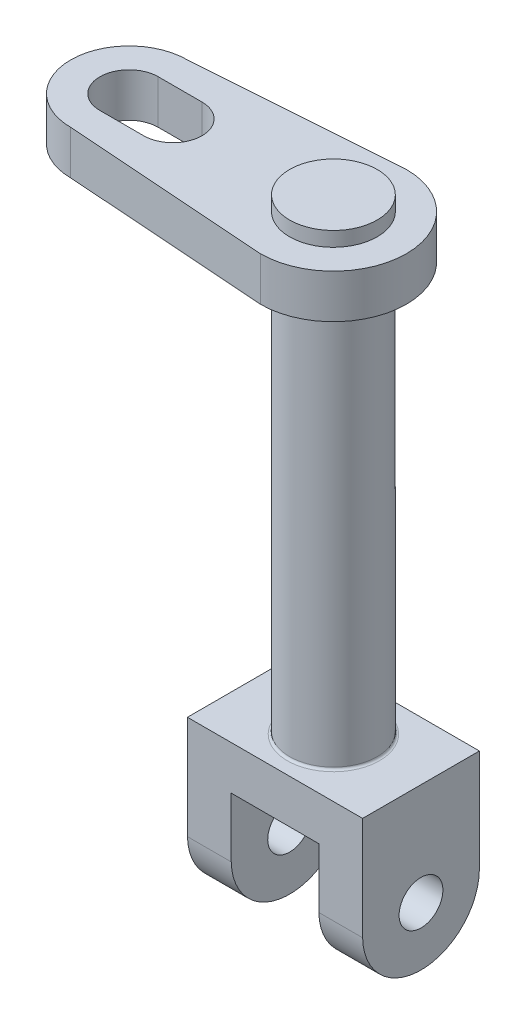
from build123d import *

# Parameters (mm, degrees)
BOSS_EXTRUDE1_DEPTH     = 12.7
CUT_EXTRUDE1_DEPTH      = 29.794641971
CUT_EXTRUDE1_DEPTH_BACK = 29.794641971
CUT_EXTRUDE2_DEPTH      = 29.794641971
CUT_EXTRUDE2_DEPTH_BACK = 29.794641971
SKETCH3_R               = 2.38125
SKETCH4_R               = 4.7625
BOSS_EXTRUDE2_DEPTH     = 44.45
BOSS_EXTRUDE3_DEPTH     = 4.7625
SKETCH6_R               = 4.7625
BOSS_EXTRUDE4_DEPTH     = 1.5875
SKETCH7_R               = 3.175
CUT_EXTRUDE3_DEPTH      = 4.7625
FILLET1_R               = 0.254
BODY_MOVE_COPY4_ANGLE   = 90


with BuildPart() as part:
    # Sketch1 → Boss-Extrude1 (new body)
    with BuildSketch(Plane(origin=(0, 0, 0), x_dir=(0, 0, -1), z_dir=(1, 0, 0))):
        Polygon((9.525, 0), (-9.525, 0), (-9.525, -17.4625), (-4.7625, -17.4625), (-4.7625, -4.7625), (4.7625, -4.7625), (4.7625, -17.4625), (9.525, -17.4625), align=None)
    extrude(amount=BOSS_EXTRUDE1_DEPTH)

    # Sketch2 → Cut-Extrude1 (cut, two sides: drawn at the far end of the back side and taken through both)
    with BuildSketch(Plane.XY.offset(9.525).offset(-CUT_EXTRUDE1_DEPTH_BACK)):
        with BuildLine():
            ThreePointArc((12.7, -11.1125), (10.840128061, -15.602628061), (6.35, -17.4625))
            Line((6.35, -17.4625), (12.7, -17.4625))
            Line((12.7, -17.4625), (12.7, -11.1125))
        make_face()
        with BuildLine():
            Line((0.001322974, -11.242114905), (0, -11.242128408))
            Line((0, -11.242128408), (0, -17.4625))
            Line((0, -17.4625), (6.35, -17.4625))
            ThreePointArc((6.35, -17.4625), (1.905933993, -15.648222359), (0.001322974, -11.242114905))
        make_face()
    extrude(amount=CUT_EXTRUDE1_DEPTH + CUT_EXTRUDE1_DEPTH_BACK, mode=Mode.SUBTRACT)

    # Sketch3 → Cut-Extrude2 (cut, two sides: drawn at the far end of the back side and taken through both)
    with BuildSketch(Plane(origin=(0, 0, -9.525), x_dir=(-1, 0, 0), z_dir=(0, 0, -1)).offset(-CUT_EXTRUDE2_DEPTH_BACK)):
        with Locations((-6.35, -11.1125)):
            Circle(SKETCH3_R)
    extrude(amount=CUT_EXTRUDE2_DEPTH + CUT_EXTRUDE2_DEPTH_BACK, mode=Mode.SUBTRACT)

    # Sketch4 → Boss-Extrude2 (add)
    with BuildSketch(Plane(origin=(0, 0, 0), x_dir=(1, 0, 0), z_dir=(0, 1, 0))):
        with Locations((6.35, 0)):
            Circle(SKETCH4_R)
    extrude(amount=BOSS_EXTRUDE2_DEPTH)

    # Sketch5 → Boss-Extrude3 (add)
    with BuildSketch(Plane(origin=(0, 44.45, 0), x_dir=(1, 0, 0), z_dir=(0, 1, 0))):
        with BuildLine():
            Line((6.35, 7.9375), (-15.875, 6.35))
            ThreePointArc((-15.875, 6.35), (-22.225, 0), (-15.875, -6.35))
            Line((-15.875, -6.35), (6.35, -7.9375))
            ThreePointArc((6.35, -7.9375), (14.2875, 0), (6.35, 7.9375))
        make_face()
        with BuildLine():
            Line((-11.1125, -3.175), (-15.875, -3.175))
            ThreePointArc((-15.875, -3.175), (-19.05, 0), (-15.875, 3.175))
            Line((-15.875, 3.175), (-11.1125, 3.175))
            ThreePointArc((-11.1125, 3.175), (-7.9375, 0), (-11.1125, -3.175))
        make_face(mode=Mode.SUBTRACT)
    extrude(amount=BOSS_EXTRUDE3_DEPTH)

    # Sketch6 → Boss-Extrude4 (add)
    with BuildSketch(Plane(origin=(0, 49.2125, 0), x_dir=(1, 0, 0), z_dir=(0, 1, 0))):
        with Locations((6.35, 0)):
            Circle(SKETCH6_R)
    extrude(amount=BOSS_EXTRUDE4_DEPTH)

    # Sketch7 → Cut-Extrude3 (cut)
    with BuildSketch(Plane.XZ.offset(4.7625)):
        with Locations((6.350661487, 0)):
            Circle(SKETCH7_R)
    extrude(amount=-CUT_EXTRUDE3_DEPTH, mode=Mode.SUBTRACT)

    # Fillet1
    fillet1_edges = [part.edges().sort_by_distance(p)[0] for p in [
        (1.5875, 0, 0),
        (1.5875, 44.45, 0),
    ]]
    fillet(fillet1_edges, radius=FILLET1_R)


with BuildPart() as body_2:
    # Split2: the piece on the far side of the plane
    add(part.part)
    split(bisect_by=Plane(origin=(12.7, 0, -9.525), x_dir=(0, 0, -1), z_dir=(0, -1, 0)), keep=Keep.BOTTOM)


with BuildPart() as part_1:
    add(part.part)

    # Split2
    split(bisect_by=Plane(origin=(12.7, 0, -9.525), x_dir=(0, 0, -1), z_dir=(0, -1, 0)), keep=Keep.TOP)


with BuildPart() as part_2:
    # Body-Move/Copy4: moved
    add(part_1.part.moved(Location((0, 0, 0))).rotate(Axis((6.35, 0, 0), (0, 1, 0)), BODY_MOVE_COPY4_ANGLE))


solid = Compound([body_2.part, part_2.part])
